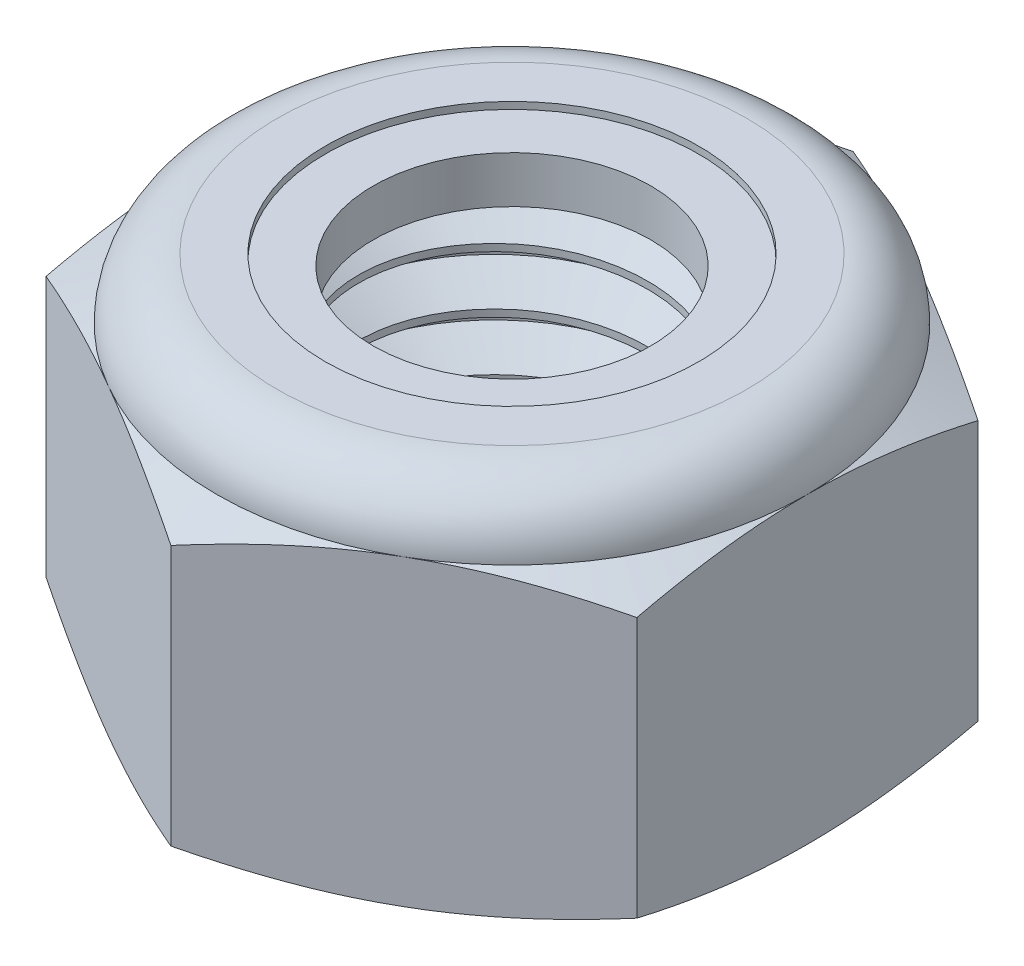
from build123d import *

# Parameters (mm, degrees)
EXTRUDE1_DEPTH   = 8
SKETCH2_W        = 4
SKETCH2_H        = 8
CUT_SWEEP1_PITCH = 1.25


with BuildPart() as part:
    # Sketch1 → Extrude1 (new body)
    with BuildSketch(Plane(origin=(0, 0, 0), x_dir=(1, 0, 0), z_dir=(0, 1, 0))):
        Polygon((0, 7.505553499), (-6.5, 3.75277675), (-6.5, -3.75277675), (0, -7.505553499), (6.5, -3.75277675), (6.5, 3.75277675), align=None)
    extrude(amount=EXTRUDE1_DEPTH)


with BuildPart() as body_2:
    # Sketch2 → Revolve1 (revolve)
    with BuildSketch(Plane(origin=(0, 0, 0), x_dir=(0, 0, -1), z_dir=(1, 0, 0))):
        with Locations((2, 4)):
            Rectangle(SKETCH2_W, SKETCH2_H)
    revolve(axis=Axis((0, -4, 0), (0, 1, 0)))

    # Boss-Extrude1 cone 1 section (through the dimple's axis) → Boss-Extrude1 (revolve)
    with BuildSketch(Plane(origin=(0, 0, 0), x_dir=(0, 0, -1), z_dir=(1, 0, 0))):
        Polygon((0, 0), (4, 0), (0, 4), align=None)
    revolve(axis=Axis((0, 0, 0), (0, 1, 0)))

    # Boss-Extrude2 cone 1 section (through the dimple's axis) → Boss-Extrude2 (revolve)
    with BuildSketch(Plane(origin=(0, 8, 0), x_dir=(0, 0, 1), z_dir=(1, 0, 0))):
        Polygon((0, 0), (4, 0), (0, 4), align=None)
    revolve(axis=Axis((0, 8, 0), (0, -1, 0)))

    # Cut-Sweep1: the profile of Sketch9 profile screwed along a right-hand helix of 7.4 turns, 8 arcs to a turn; built about Z, then put on its axis
    cut_sweep1_z = Axis((0, 0, 0), (0, 0, 1))
    cut_sweep1_corners = [(4.0003, 0, -1.093923205), (4.0003, 0, 0.000173205), (3.188101184, 0, -0.46875), (3.188101184, 0, -0.625)]
    with BuildLine(mode=Mode.PRIVATE) as cut_sweep1_profile:
        Line(cut_sweep1_corners[0], cut_sweep1_corners[1])
        Line(cut_sweep1_corners[1], cut_sweep1_corners[2])
        Line(cut_sweep1_corners[2], cut_sweep1_corners[3])
        Line(cut_sweep1_corners[3], cut_sweep1_corners[0])
    cut_sweep1_cap = Face(cut_sweep1_profile.wire())
    cut_sweep1_turn_angles = [0, 22.5, 45, 67.5, 90, 112.5, 135, 157.5, 180, 202.5, 225, 247.5, 270, 292.5, 315, 337.5, 360]
    cut_sweep1_turn_weights = [1, 0.9238795325112867, 1, 0.9238795325112867, 1, 0.9238795325112867, 1, 0.9238795325112867, 1, 0.9238795325112867, 1, 0.9238795325112867, 1, 0.9238795325112867, 1, 0.9238795325112867, 1]
    cut_sweep1_turn_rails = [Edge.make_bspline([Vector(p[0], p[1], 0).rotate(cut_sweep1_z, cut_sweep1_turn_angles[k]) / cut_sweep1_turn_weights[k] + Vector(0, 0, p[2] + CUT_SWEEP1_PITCH * cut_sweep1_turn_angles[k] / 360) for k in range(17)], [0, 0, 0, 1, 1, 2, 2, 3, 3, 4, 4, 5, 5, 6, 6, 7, 7, 8, 8, 8], 2, cut_sweep1_turn_weights) for p in cut_sweep1_corners]
    cut_sweep1_turn_sides = [Face.make_surface_from_curves(cut_sweep1_turn_rails[p[0]], cut_sweep1_turn_rails[p[1]]) for p in [(0, 1), (1, 2), (2, 3), (3, 0)]]
    cut_sweep1_last_angles = [2520, 2542.5, 2565, 2587.5, 2610, 2632.5, 2655, 2659.5, 2664]
    cut_sweep1_last_weights = [1, 0.9238795325112867, 1, 0.9238795325112867, 1, 0.9238795325112867, 1, 0.9969173337331261, 1]
    cut_sweep1_last_rails = [Edge.make_bspline([Vector(p[0], p[1], 0).rotate(cut_sweep1_z, cut_sweep1_last_angles[k]) / cut_sweep1_last_weights[k] + Vector(0, 0, p[2] + CUT_SWEEP1_PITCH * cut_sweep1_last_angles[k] / 360) for k in range(9)], [0, 0, 0, 1, 1, 2, 2, 3, 3, 4, 4, 4], 2, cut_sweep1_last_weights) for p in cut_sweep1_corners]
    cut_sweep1_last_sides = [Face.make_surface_from_curves(cut_sweep1_last_rails[p[0]], cut_sweep1_last_rails[p[1]]) for p in [(0, 1), (1, 2), (2, 3), (3, 0)]]
    cut_sweep1 = Plane(origin=(0, 0, 0), x_dir=(0, 0, -1), z_dir=(0, 1, 0)) * Solid(Shell([*[p.moved(Location((0, 0, CUT_SWEEP1_PITCH * i))) for i in range(7) for p in cut_sweep1_turn_sides], *cut_sweep1_last_sides, cut_sweep1_cap, cut_sweep1_cap.rotate(cut_sweep1_z, 2664).moved(Location((0, 0, CUT_SWEEP1_PITCH * 2664 / 360)))]))
    add(cut_sweep1, mode=Mode.SUBTRACT)


with BuildPart() as part_1:
    add(part.part)

    # Combine1: cut body 2
    add(body_2.part, mode=Mode.SUBTRACT)

    # Sketch5 → Cut-Revolve3 (revolve, cut)
    with BuildSketch(Plane(origin=(0, 0, 0), x_dir=(0, 0, -1), z_dir=(1, 0, 0))):
        with BuildLine():
            Line((0, 0), (6.5, 0))
            Line((6.5, 0), (7.505553499, 0.468897297))
            Line((7.505553499, 0.468897297), (7.505553499, 6.197769369))
            Line((7.505553499, 6.197769369), (6.5, 6.666666667))
            ThreePointArc((6.5, 6.666666667), (6.109475708, 7.609475708), (5.166666667, 8))
            Line((5.166666667, 8), (5.166666667, 9.27))
            Line((5.166666667, 9.27), (8.775553499, 9.27))
            Line((8.775553499, 9.27), (8.775553499, -1.27))
            Line((8.775553499, -1.27), (0, -1.27))
            Line((0, -1.27), (0, 0))
        make_face()
    revolve(axis=Axis((0, 0, 0), (0, 1, 0)), mode=Mode.SUBTRACT)

    # Sketch6 → Cut-Revolve4 (revolve, cut)
    with BuildSketch(Plane(origin=(0, 0, 0), x_dir=(0, 0, -1), z_dir=(1, 0, 0)), mode=Mode.PRIVATE) as cut_revolve4_sk:
        with BuildLine():
            Line((0, 6.666666667), (6.3476, 6.666666667))
            ThreePointArc((6.3476, 6.666666667), (6.001712635, 7.501712635), (5.166666667, 7.8476))
            Line((5.166666667, 7.8476), (4.109725691, 7.8476))
            Line((4.109725691, 7.8476), (4.109725691, 9.27))
            Line((4.109725691, 9.27), (0, 9.27))
            Line((0, 9.27), (0, 6.666666667))
        make_face()
    revolve(cut_revolve4_sk.sketch.rotate(Axis((0, 9.27, 0), (0, -1, 0)), 180), axis=Axis((0, 9.27, 0), (0, -1, 0)), mode=Mode.SUBTRACT)


with BuildPart() as body_2_2:
    # Sketch7 → Revolve2 (revolve)
    with BuildSketch(Plane(origin=(0, 0, 0), x_dir=(0, 0, -1), z_dir=(1, 0, 0))):
        with BuildLine():
            Line((3.052784715, 6.742866667), (6.268768884, 6.742866667))
            ThreePointArc((6.268768884, 6.742866667), (5.920409016, 7.474322663), (5.166666667, 7.7714))
            Line((5.166666667, 7.7714), (3.052784715, 7.7714))
            Line((3.052784715, 7.7714), (3.052784715, 6.742866667))
        make_face()
    revolve(axis=Axis((0, 6.742866667, 0), (0, 1, 0)))


solid = Compound([part_1.part, body_2_2.part])
